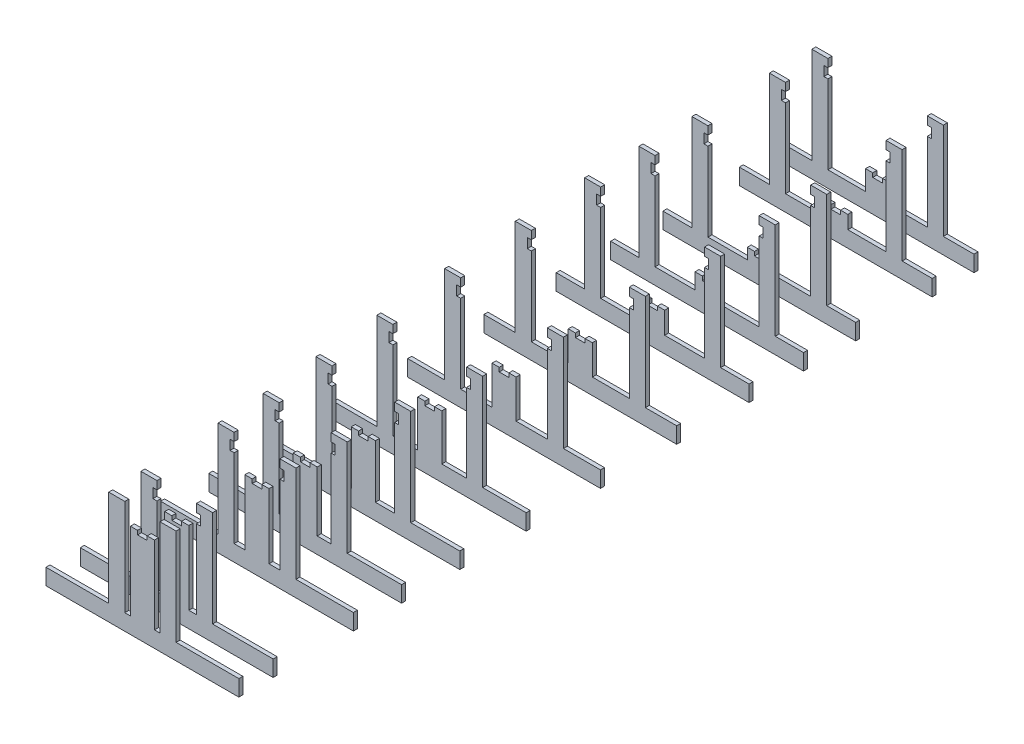
from build123d import *

# Parameters (mm, degrees)
EXTRUDE_F0_DEPTH  = 6.35
EXTRUDE_F1_DEPTH  = 6.35
EXTRUDE_F2_DEPTH  = 6.35
EXTRUDE_F3_DEPTH  = 6.35
EXTRUDE_F4_DEPTH  = 6.35
EXTRUDE_F5_DEPTH  = 6.35
EXTRUDE_F6_DEPTH  = 6.35
EXTRUDE_F7_DEPTH  = 6.35
EXTRUDE_F8_DEPTH  = 6.35
EXTRUDE_F9_DEPTH  = 6.35
EXTRUDE_F10_DEPTH = 6.35
EXTRUDE_F11_DEPTH = 6.35
EXTRUDE_F12_DEPTH = 6.35


with BuildPart() as part:
    # Sketch1 → Extrude F0 (new body)
    with BuildSketch(Plane.XY):
        Polygon((152.4, 0), (-152.4, 0), (-152.4, 25.4), (-103.932241462, 25.4), (-103.932241462, 177.8), (-78.532241462, 177.8), (-78.532241462, 165.1), (-84.882241462, 165.1), (-84.882241462, 149.86), (-78.532241462, 149.86), (-78.532241462, 25.4), (-19.05, 25.4), (-19.05, 56.731142316), (-7.62, 56.731142316), (-7.62, 50.381142316), (7.62, 50.381142316), (7.62, 56.731142316), (19.05, 56.731142316), (19.05, 25.4), (78.532241462, 25.4), (78.532241462, 149.86), (84.882241462, 149.86), (84.882241462, 165.1), (78.532241462, 165.1), (78.532241462, 177.8), (103.932241462, 177.8), (103.932241462, 25.4), (152.4, 25.4), align=None)
    extrude(amount=EXTRUDE_F0_DEPTH)


with BuildPart() as body_2:
    # 3DSketch1 → Extrude F1 (new body)
    with BuildSketch(Plane(origin=(152.532826884, 0, 66.26895941), x_dir=(-0.8226366272792537, 0.5685674801275695, 0), z_dir=(0, 0, 1))):
        Polygon((0, 0), (250.739643995, 173.299367943), (265.18125799, 152.40439761), (226.066055522, 125.369821997), (312.715739493, 0), (291.820769161, -14.441613995), (284.599962163, -3.994128829), (289.823704746, -0.38372533), (281.158736349, 12.15325687), (275.934993766, 8.542853371), (205.171085189, 110.928208002), (155.482663742, 76.585924135), (167.414254028, 59.322602658), (158.011517378, 52.82387636), (154.401113879, 58.047618944), (141.86413168, 49.382650546), (145.474535178, 44.158907963), (136.071798529, 37.660181665), (124.140208243, 54.923503142), (74.451786796, 20.581219275), (145.215695373, -81.804135356), (139.99195279, -85.414538855), (148.656921187, -97.951521055), (153.88066377, -94.341117556), (161.101470768, -104.788602722), (140.206500435, -119.230216718), (53.556816463, 6.13960528), (14.441613995, -20.894970333), align=None)
    extrude(amount=EXTRUDE_F1_DEPTH)


with BuildPart() as body_3:
    # 3DSketch2 → Extrude F2 (new body)
    with BuildSketch(Plane(origin=(-152.4, 0, 186.91895941), x_dir=(0.8244079406565273, 0.5659960665786149, 0), z_dir=(0, 0, -1))):
        Polygon((0, 0), (251.279540312, 172.515601093), (265.655840403, 151.5756394), (227.878658166, 125.639770156), (314.136458712, 0), (293.196497019, -14.376300091), (286.008346974, -3.906319245), (291.243337397, -0.312244222), (282.617557342, 12.251732794), (277.382566919, 8.657657771), (206.938696473, 111.263470065), (155.721041517, 76.100063922), (165.455883398, 61.920670421), (156.032900637, 55.45133538), (152.438825614, 60.686325803), (139.874848598, 52.060545748), (143.468923621, 46.825555325), (134.045940859, 40.356220284), (124.311098978, 54.535613786), (73.093444021, 19.372207643), (143.537314468, -83.233604651), (138.302324045, -86.827679674), (146.928104099, -99.39165669), (152.163094522, -95.797581667), (159.351244568, -106.267562513), (138.411282875, -120.643862604), (52.153482329, 4.995907552), (14.376300091, -20.939961693), align=None)
    extrude(amount=-EXTRUDE_F2_DEPTH)


with BuildPart() as body_4:
    # 3DSketch3 → Extrude F3 (new body)
    with BuildSketch(Plane(origin=(-19.05, 50.244461868, 269.46895941), x_dir=(0.7048152045038111, 0.7093909553273506, 0), z_dir=(0, 0, -1))):
        Polygon((0, 0), (8.056037787, 8.108338619), (3.551405221, 12.583915168), (14.292788938, 23.395033327), (18.797421504, 18.919456779), (26.853459292, 27.027795398), (9.229022752, 44.53854987), (53.796442372, 89.395306901), (142.087240672, 1.674006549), (146.56281722, 6.178639115), (157.373935379, -4.562744602), (152.898358831, -9.067377168), (161.907623963, -18.018530265), (179.809930158, 0), (71.698748566, 107.413837166), (103.216130273, 139.135833763), (85.197600008, 157.038139958), (-129.630074325, -59.184223226), (-111.61154406, -77.086529421), (-80.094162353, -45.364532824), (28.017019239, -152.77836999), (45.919325434, -134.759839725), (36.910060301, -125.808686628), (32.434483752, -130.313319194), (21.623365593, -119.571935477), (26.098942142, -115.067302911), (-62.191856158, -27.346002559), (-17.624436539, 17.510754472), align=None)
    extrude(amount=-EXTRUDE_F3_DEPTH)


with BuildPart() as body_5:
    # 3DSketch4 → Extrude F4 (new body)
    with BuildSketch(Plane(origin=(-19.05, 59.777391494, 355.6), x_dir=(0.9442528340281553, -0.32922118010510376, 0), z_dir=(0, 0, 1))):
        Polygon((0, 0), (10.792809893, 3.762998089), (12.883364387, -2.233007407), (27.273777577, 2.784323377), (25.183223084, 8.780328873), (35.976032976, 12.543326962), (47.293798373, -19.917622383), (106.802738584, 0.830637847), (65.827870508, 118.35234557), (71.823876004, 120.442900064), (66.806545219, 134.833313254), (60.810539723, 132.742758761), (56.629430736, 144.734769753), (80.61345272, 153.096987728), (130.786760568, 9.192855822), (173.209913791, 23.984021984), (181.572131765, 0), (-106.236132046, -100.346615696), (-114.598350021, -76.362593712), (-72.175196799, -61.571427549), (-122.348504647, 82.332704357), (-98.364482662, 90.694922332), (-94.183373675, 78.702911339), (-100.179379171, 76.612356846), (-95.162048386, 62.221943655), (-89.16604289, 64.312498149), (-48.191174814, -53.209209574), (11.317765397, -32.460949345), align=None)
    extrude(amount=EXTRUDE_F4_DEPTH)


with BuildPart() as body_6:
    # 3DSketch5 → Extrude F5 (new body)
    with BuildSketch(Plane(origin=(19.05, 72.42885438, 469.9), x_dir=(-0.9211747377275616, -0.38914920348441956, 0), z_dir=(0, 0, -1))):
        Polygon((0, 0), (10.529027252, 4.447975396), (13.000124694, -1.401484189), (27.038827697, 4.529149672), (24.567730255, 10.378609257), (35.096757507, 14.826584653), (53.39799873, -28.495207946), (107.1745143, -5.777381086), (58.778289151, 108.783768236), (64.627748736, 111.254865678), (58.659830158, 125.381827217), (52.810370574, 122.910729775), (47.868175689, 134.609648944), (71.266014028, 144.494038713), (130.572352639, 4.107008683), (176.236650006, 23.397838338), (186.121039775, 0), (-94.653020285, -118.612677222), (-104.537410053, -95.214838884), (-58.873112686, -75.924009228), (-118.179451297, 64.463020801), (-94.781612958, 74.34741057), (-89.839418074, 62.648491401), (-95.688877659, 60.177393958), (-89.720959081, 46.050432419), (-83.871499496, 48.521529861), (-35.475274347, -66.03961946), (18.301241223, -43.321792599), align=None)
    extrude(amount=-EXTRUDE_F5_DEPTH)


with BuildPart() as body_7:
    # 3DSketch6 → Extrude F6 (new body)
    with BuildSketch(Plane(origin=(68.619768762, 177.8, 590.55), x_dir=(-0.7790008980535703, -0.6270228072659966, 0), z_dir=(0, 0, 1))):
        Polygon((0, 0), (7.963189652, 9.893311405), (3.01653395, 13.874906231), (12.572361532, 25.746879918), (17.519017235, 21.765285092), (95.558275827, 118.719736863), (134.076169867, 87.716437495), (96.201480652, 40.661662821), (105.105460917, 33.494792134), (109.087055743, 38.441447837), (120.95902943, 28.885620254), (116.977434604, 23.938964552), (125.881414868, 16.772093864), (163.756104082, 63.826868538), (202.273998122, 32.82356917), (124.234739529, -64.130882602), (129.181395232, -68.112477428), (119.625567649, -79.984451114), (114.678911947, -76.002856288), (106.715722294, -85.896167693), (126.502345105, -101.822546998), (222.060620932, 16.897189866), (267.635873838, -19.786622811), (283.562253142, 0), (46.122779416, 191.116551655), (30.196400111, 171.329928844), (75.771653017, 134.646116168), (-19.786622811, 15.926379305), align=None)
    extrude(amount=EXTRUDE_F6_DEPTH)


with BuildPart() as body_8:
    # 3DSketch7 → Extrude F7 (new body)
    with BuildSketch(Plane(origin=(58.203972492, 177.8, 707.908450974), x_dir=(-0.7641074482866729, -0.6450889919017606, 0), z_dir=(0, 0, 1))):
        Polygon((0, 0), (8.192630197, 9.704164593), (3.340547901, 13.800479692), (13.171704137, 25.445477204), (18.023786434, 21.349162105), (98.311562366, 116.449975119), (128.229404377, 91.192178475), (81.32332387, 35.631959753), (90.057072004, 28.258592576), (94.153387103, 33.110674872), (105.798384615, 23.279518636), (101.702069516, 18.427436339), (110.43581765, 11.054069162), (157.341898157, 66.614287884), (187.259740168, 41.35649124), (106.971964236, -53.744321774), (111.824046532, -57.840636873), (101.992890296, -69.485634384), (97.140807999, -65.389319286), (88.948177802, -75.093483879), (108.356506989, -91.478744273), (206.668069354, 24.971230846), (259.235626386, -19.408329186), (275.62088678, 0), (42.720936542, 196.623124732), (26.335676148, 177.214795545), (78.903233179, 132.835235513), (-19.408329186, 16.385260394), align=None)
    extrude(amount=EXTRUDE_F7_DEPTH)


with BuildPart() as body_9:
    # 3DSketch8 → Extrude F8 (new body)
    with BuildSketch(Plane(origin=(-19.05, 109.751984712, 812.79999989), x_dir=(0.8422179024529879, -0.5391372782396793, 0), z_dir=(0, 0, -1))):
        Polygon((0, 0), (9.626550625, -6.16233909), (13.050072342, -0.81425541), (25.885473175, -9.03070753), (22.461951458, -14.378791211), (32.088502083, -20.541130301), (77.565801535, 50.501621331), (103.211727981, 34.084640711), (36.110702332, -70.737799428), (41.458786012, -74.161321145), (33.242333892, -86.996721978), (27.894250211, -83.573200261), (21.047206778, -94.269367622), (42.4395415, -107.96345449), (124.604062704, 20.390553844), (189.875558827, -21.392334722), (203.569645695, 0), (-53.138370973, 164.329042407), (-66.83245784, 142.936707685), (-1.560961717, 101.153819119), (-83.72548292, -27.200189215), (-62.333148198, -40.894276082), (-55.486104764, -30.198108721), (-60.834188445, -26.774587004), (-52.617736325, -13.939186171), (-47.269652644, -17.362707888), (19.831373006, 87.459732251), (45.477299452, 71.042751632), align=None)
    extrude(amount=-EXTRUDE_F8_DEPTH)


with BuildPart() as body_10:
    # 3DSketch9 → Extrude F9 (new body)
    with BuildSketch(Plane(origin=(-40.912711924, 177.8, 904.87499989), x_dir=(0.7362329224084927, -0.6767282201606865, 0), z_dir=(0, 0, -1))):
        Polygon((0, 0), (8.594448396, 9.350158115), (3.919369339, 13.647382313), (14.232707414, 24.86757205), (18.907786471, 20.570347852), (103.133380752, 112.201897375), (119.318689488, 97.324737117), (55.382526062, 27.7666678), (63.797668365, 20.031664244), (68.094892563, 24.706743301), (79.315082301, 14.393405226), (75.017858103, 9.718326168), (83.433000406, 1.983322612), (147.369163832, 71.541391929), (163.554472568, 56.664231672), (79.328878287, -34.967317851), (84.003957344, -39.264542049), (73.690619269, -50.484731787), (69.015540212, -46.187507589), (60.421091816, -55.537665703), (79.121408045, -72.726562496), (182.254788797, 39.475334879), (245.545824035, -18.700316229), (262.734720827, 0), (38.330926077, 206.266761505), (21.142029285, 187.566445276), (84.433064523, 129.390794167), (-18.700316229, 17.188896792), align=None)
    extrude(amount=-EXTRUDE_F9_DEPTH)


with BuildPart() as body_11:
    # 3DSketch10 → Extrude F10 (new body)
    with BuildSketch(Plane(origin=(-36.076515983, 177.8, 981.07499989), x_dir=(0.7276293458461269, -0.6859705059720406, 0), z_dir=(0, 0, -1))):
        Polygon((0, 0), (8.711825426, 9.240892692), (4.09137908, 13.596805405), (14.545569591, 24.685876636), (19.166015937, 20.329963923), (104.54190511, 110.890712307), (117.019115149, 99.127857864), (46.424068443, 24.245589301), (54.740871866, 16.404946418), (59.096784579, 21.025392764), (70.18585581, 10.571202253), (65.829943097, 5.950755907), (74.14674652, -1.889886976), (144.741793225, 72.992381587), (157.219003264, 61.229527144), (71.843114091, -29.33122124), (76.463560437, -33.687133953), (66.009369926, -44.776205183), (61.38892358, -40.42029247), (52.677098154, -49.661185163), (71.158883538, -67.084836014), (175.700788649, 43.805876293), (241.771166494, -18.481785384), (259.194817346, 0), (37.413392732, 209.08381022), (19.98974188, 190.602024836), (86.060119726, 128.314363159), (-18.481785384, 17.423650852), align=None)
    extrude(amount=-EXTRUDE_F10_DEPTH)


with BuildPart() as body_12:
    # 3DSketch11 → Extrude F11 (new body)
    with BuildSketch(Plane(origin=(-30.971540185, 177.8, 1108.07499989), x_dir=(0.7184561393730795, -0.6955722649711747, 0), z_dir=(0, 0, -1))):
        Polygon((0, 0), (8.833767765, 9.12439297), (4.27157128, 13.541276853), (14.872092598, 24.490548417), (19.434289083, 20.073664534), (106.005213182, 109.49271564), (114.770021854, 101.007078889), (34.029243317, 17.609981335), (42.24119699, 9.659590347), (46.658080873, 14.221786832), (57.607352437, 3.621265514), (53.190468554, -0.940930971), (61.402422227, -8.89132196), (142.143200764, 74.505775594), (150.908009437, 66.020138843), (64.337085339, -23.398912264), (68.899281824, -27.815796146), (58.298760505, -38.76506771), (53.73656402, -34.348183828), (44.902796255, -43.472576798), (63.151582195, -61.140112328), (169.156795377, 48.352603312), (237.94932695, -18.24878594), (255.61686248, 0), (36.631431199, 212.010426363), (18.963895669, 193.761640423), (87.756427242, 127.160251171), (-18.24878594, 17.66753553), align=None)
    extrude(amount=-EXTRUDE_F11_DEPTH)


with BuildPart() as body_13:
    # 3DSketch12 → Extrude F12 (new body)
    with BuildSketch(Plane(origin=(-19.05, 148.344137398, 1162.04999989), x_dir=(0.7562255452526494, -0.6543110305560599, 0), z_dir=(0, 0, -1))):
        Polygon((0, 0), (8.643657982, -7.478775079), (12.798533026, -2.676742867), (24.323410336, -12.648442973), (20.168535292, -17.450475185), (28.812193274, -24.929250264), (109.255898516, 68.044247075), (115.919520918, 62.278663423), (16.202519861, -52.970109674), (35.410648711, -69.58960985), (135.127649768, 45.659163247), (210.098574975, -19.208128849), (226.718075151, 0), (-3.779471042, 199.434002113), (-20.398971218, 180.225873264), (54.57195399, 115.358581168), (-45.145047067, 0.109808072), (-25.936918217, -16.509692105), (73.780082839, 98.739080992), (80.443705242, 92.973497339), align=None)
    extrude(amount=-EXTRUDE_F12_DEPTH)


solid = Compound([part.part, body_2.part, body_3.part, body_4.part, body_5.part, body_6.part, body_7.part, body_8.part, body_9.part, body_10.part, body_11.part, body_12.part, body_13.part])
